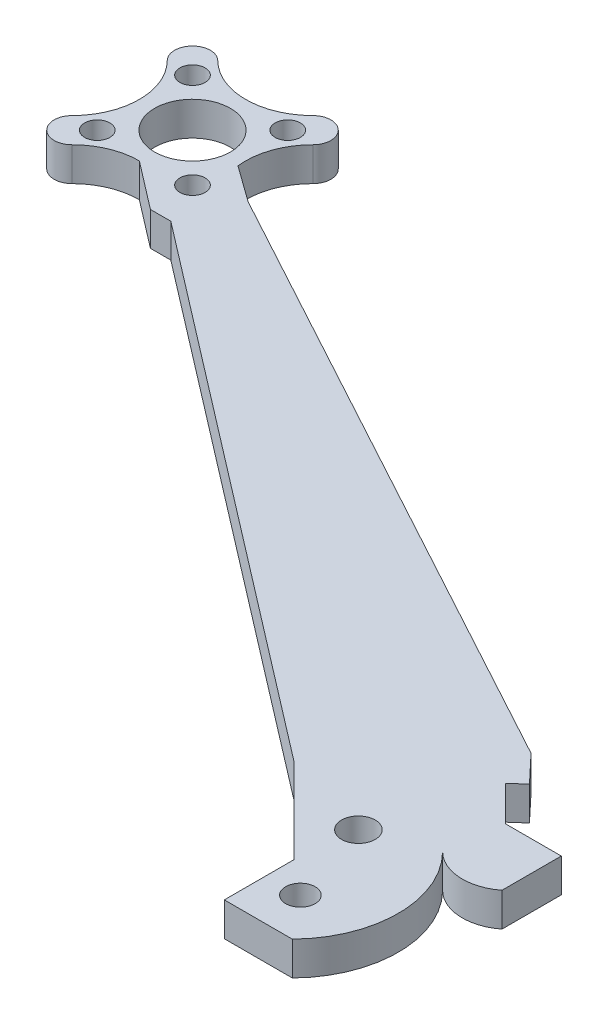
from build123d import *

# Parameters (mm, degrees)
SKETCH1_W            = 16.31
SKETCH1_H            = 16.31
SKETCH1_R            = 4.5
BOSS_EXTRUDE1_DEPTH  = 4
SKETCH3_R            = 1.5
CUT_EXTRUDE1_DEPTH   = 4
BOSS_EXTRUDE2_DEPTH  = 4
BOSS_EXTRUDE6_DEPTH  = 4
CUT_EXTRUDE3_DEPTH   = 4
BOSS_EXTRUDE7_DEPTH  = 4
BOSS_EXTRUDE9_DEPTH  = 4
SKETCH17_OUTSIDE_W   = 136.165
SKETCH17_OUTSIDE_H   = 117.232
CUT_EXTRUDE4_DEPTH   = 4
SKETCH18_R           = 1.5
BOSS_EXTRUDE10_DEPTH = 4
CUT_EXTRUDE5_DEPTH   = 4
SKETCH20_R           = 2
CUT_EXTRUDE6_DEPTH   = 10
SKETCH22_R           = 1.75
CUT_EXTRUDE8_DEPTH   = 124.744497459


with BuildPart() as part:
    # Sketch1 → Boss-Extrude1 (new body)
    with BuildSketch(Plane(origin=(0, 0, 0), x_dir=(1, 0, 0), z_dir=(0, 1, 0))):
        Rectangle(SKETCH1_W, SKETCH1_H)
        Circle(SKETCH1_R, mode=Mode.SUBTRACT)
    extrude(amount=BOSS_EXTRUDE1_DEPTH)

    # Sketch3 → Cut-Extrude1 (cut)
    with BuildSketch(Plane(origin=(0, 4, 0), x_dir=(1, 0, 0), z_dir=(0, 1, 0))):
        with Locations((5.656854249, 5.656854249)):
            Circle(SKETCH3_R)
        with Locations((5.656854249, -5.656854249)):
            Circle(SKETCH3_R)
        with Locations((-5.656854249, -5.656854249)):
            Circle(SKETCH3_R)
        with Locations((-5.656854249, 5.656854249)):
            Circle(SKETCH3_R)
    extrude(amount=-CUT_EXTRUDE1_DEPTH, mode=Mode.SUBTRACT)

    # Sketch4 → Boss-Extrude2 (add)
    with BuildSketch(Plane(origin=(0, 4, 0), x_dir=(1, 0, 0), z_dir=(0, 1, 0))):
        Polygon((8.155, -8.155), (0, -8.155), (0, -10.655), (10.655, -10.655), (10.655, 0), (8.155, 0), align=None)
    extrude(amount=-BOSS_EXTRUDE2_DEPTH)

    # Sketch9 → Boss-Extrude6 (add)
    with BuildSketch(Plane(origin=(0, 4, 0), x_dir=(1, 0, 0), z_dir=(0, 1, 0))):
        Polygon((71.061407011, -58.982568069), (7.593139788, -10.281653748), (10.613791504, -4.032054751), (84.193483815, -43.982568069), (90.501950314, -50.291034568), (96.061407011, -50.291034568), (96.061407011, -73.982568069), (81.061407011, -73.982568069), (81.061407011, -68.982568069), align=None)
    extrude(amount=-BOSS_EXTRUDE6_DEPTH)

    # Sketch12 → Cut-Extrude3 (cut)
    with BuildSketch(Plane(origin=(0, 4, 0), x_dir=(1, 0, 0), z_dir=(0, 1, 0))):
        Polygon((87.278639473, -47.258318902), (85.780514725, -48.583317861), (89.960889469, -52.761034568), (90.501950314, -52.761034568), (96.061407011, -52.761034568), (96.061407011, -50.291034568), (90.501950314, -50.291034568), (87.347717064, -47.136801318), align=None)
    extrude(amount=-CUT_EXTRUDE3_DEPTH, mode=Mode.SUBTRACT)

    # Sketch13 → Boss-Extrude7 (add)
    with BuildSketch(Plane(origin=(0, 4, 0), x_dir=(1, 0, 0), z_dir=(0, 1, 0))):
        Polygon((81.061407011, -73.982568069), (81.061407011, -77.282568069), (96.561407011, -77.282568069), (96.561407011, -52.761034568), (96.061407011, -52.761034568), (96.061407011, -73.982568069), align=None)
    extrude(amount=-BOSS_EXTRUDE7_DEPTH)

    # Sketch16 → Boss-Extrude9 (add)
    with BuildSketch(Plane(origin=(0, 4, 0), x_dir=(1, 0, 0), z_dir=(0, 1, 0))):
        Polygon((0, -10.655), (-10, -10.655), (-10, 10.345), (10.655, 10.345), (10.655, 0), (8.155, 0), (8.155, 8.155), (-8.155, 8.155), (-8.155, -8.155), (0, -8.155), align=None)
    extrude(amount=-BOSS_EXTRUDE9_DEPTH)

    # Sketch17 outside → Cut-Extrude4 (cut)
    with BuildSketch(Plane(origin=(0, 4, 0), x_dir=(1, 0, 0), z_dir=(0, 1, 0))):
        with Locations((43.2805, -33.469)):
            Rectangle(SKETCH17_OUTSIDE_W, SKETCH17_OUTSIDE_H)
        with BuildLine():
            Line((5.656854249, -8.656854249), (5.656854249, -10.655))
            Line((5.656854249, -10.655), (8.079694096, -10.655))
            Line((8.079694096, -10.655), (71.061407011, -58.982568069))
            Line((71.061407011, -58.982568069), (81.061407011, -68.982568069))
            Line((81.061407011, -68.982568069), (81.061407011, -77.282568069))
            Line((81.061407011, -77.282568069), (96.561407011, -77.282568069))
            Line((96.561407011, -77.282568069), (96.561407011, -52.761034568))
            Line((96.561407011, -52.761034568), (89.960889469, -52.761034568))
            Line((89.960889469, -52.761034568), (85.780514725, -48.583317861))
            Line((85.780514725, -48.583317861), (87.278639473, -47.258318902))
            Line((87.278639473, -47.258318902), (84.193483815, -43.982568069))
            Line((84.193483815, -43.982568069), (10.655, -4.054429139))
            Line((10.655, -4.054429139), (8.656854249, -5.656854249))
            ThreePointArc((8.656854249, -5.656854249), (6.313708499, 0), (8.656854249, 5.656854249))
            ThreePointArc((8.656854249, 5.656854249), (8.656854249, 8.656854249), (5.656854249, 8.656854249))
            ThreePointArc((5.656854249, 8.656854249), (0, 6.313708499), (-5.656854249, 8.656854249))
            ThreePointArc((-5.656854249, 8.656854249), (-8.656854249, 8.656854249), (-8.656854249, 5.656854249))
            ThreePointArc((-8.656854249, 5.656854249), (-6.313708499, 0), (-8.656854249, -5.656854249))
            ThreePointArc((-8.656854249, -5.656854249), (-8.656854249, -8.656854249), (-5.656854249, -8.656854249))
            ThreePointArc((-5.656854249, -8.656854249), (0, -6.313708499), (5.656854249, -8.656854249))
        make_face(mode=Mode.SUBTRACT)
    extrude(amount=-CUT_EXTRUDE4_DEPTH, mode=Mode.SUBTRACT)

    # Sketch18 → Boss-Extrude10 (add)
    with BuildSketch(Plane(origin=(0, 4, 0), x_dir=(1, 0, 0), z_dir=(0, 1, 0))):
        Polygon((5.656854249, -10.655), (0, -6.313708499), (6.372805828, -0.97060021), (10.655, -4.054429139), (8.656854249, -5.656854249), align=None)
        with Locations((5.656854249, -5.656854249)):
            Circle(SKETCH18_R, mode=Mode.SUBTRACT)
    extrude(amount=-BOSS_EXTRUDE10_DEPTH)

    # Sketch19 → Cut-Extrude5 (cut)
    with BuildSketch(Plane(origin=(0, 4, 0), x_dir=(1, 0, 0), z_dir=(0, 1, 0))):
        with BuildLine():
            Line((97.061407011, -77.355955856), (97.061407011, -59.355955856))
            ThreePointArc((97.061407011, -59.355955856), (93.061407011, -61.012810105), (89.061407011, -59.355955856))
            ThreePointArc((89.061407011, -59.355955856), (92.789329073, -68.355955856), (89.061407011, -77.355955856))
            Line((89.061407011, -77.355955856), (97.061407011, -77.355955856))
        make_face()
    extrude(amount=-CUT_EXTRUDE5_DEPTH, mode=Mode.SUBTRACT)

    # Sketch20 → Cut-Extrude6 (cut)
    with BuildSketch(Plane.XZ):
        with Locations((81.807805677, 62.103797793)):
            Circle(SKETCH20_R)
    extrude(amount=-CUT_EXTRUDE6_DEPTH, mode=Mode.SUBTRACT)

    # Sketch22 → Cut-Extrude8 (cut, through all)
    with BuildSketch(Plane.XZ):
        with Locations((85.097804106, 72.282568069)):
            Circle(SKETCH22_R)
    extrude(amount=-CUT_EXTRUDE8_DEPTH, mode=Mode.SUBTRACT)


solid = part.part
